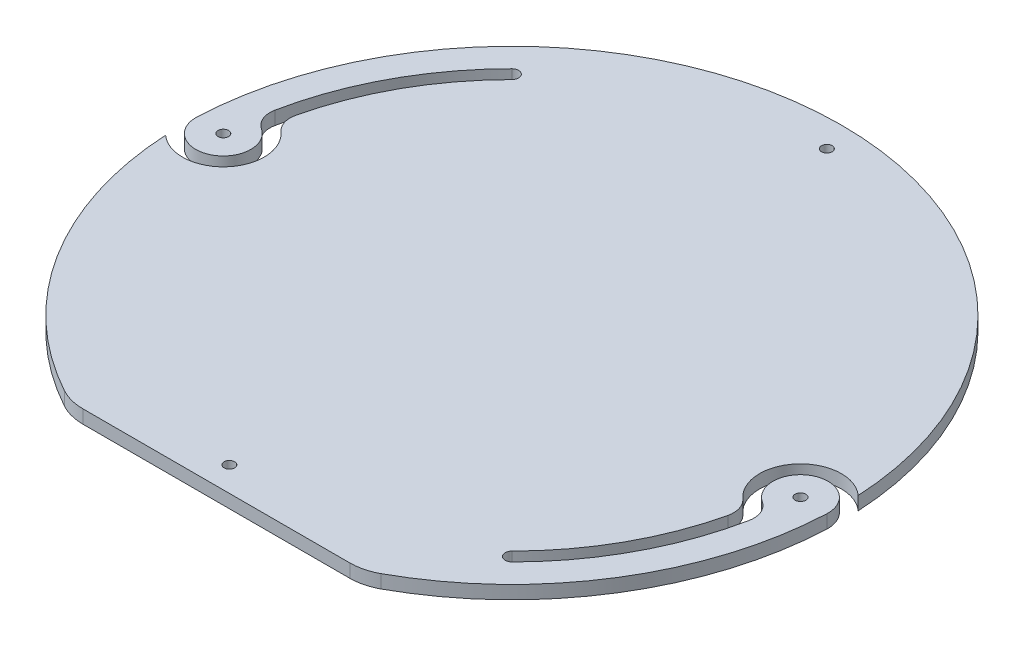
from build123d import *

# Parameters (mm, degrees)
BOSS_EXTRUDE1_DEPTH = 3
SKETCH2_R           = 1.2
CUT_EXTRUDE1_DEPTH  = 105.977521403
CUT_EXTRUDE2_DEPTH  = 105.977521403


with BuildPart() as part:
    # Sketch1 → Boss-Extrude1 (new body)
    with BuildSketch(Plane(origin=(0, 0, 0), x_dir=(1, 0, 0), z_dir=(0, 1, 0))):
        with BuildLine():
            Line((-30.029977361, -66.512867647), (30.029977361, -66.512867647))
            ThreePointArc((30.029977361, -66.512867647), (32.931413623, -66.147401939), (35.651589123, -65.073836471))
            ThreePointArc((35.651589123, -65.073836471), (0, 74.2), (-35.651589123, -65.073836471))
            ThreePointArc((-35.651589123, -65.073836471), (-32.931413623, -66.147401939), (-30.029977361, -66.512867647))
        make_face()
    extrude(amount=BOSS_EXTRUDE1_DEPTH)

    # Sketch2 → Cut-Extrude1 (cut, through all)
    with BuildSketch(Plane(origin=(0, 3, 0), x_dir=(1, 0, 0), z_dir=(0, 1, 0))):
        with Locations((-2.660782629, -60.941941516)):
            Circle(SKETCH2_R)
        with Locations((-67.935279068, 2.966118341)):
            Circle(SKETCH2_R)
        with Locations((2.966118341, 67.935279068)):
            Circle(SKETCH2_R)
        with Locations((67.935279068, -2.966118341)):
            Circle(SKETCH2_R)
    extrude(amount=-CUT_EXTRUDE1_DEPTH, mode=Mode.SUBTRACT)

    # Sketch3 → Cut-Extrude2 (cut, through all)
    with BuildSketch(Plane(origin=(0, 3, 0), x_dir=(1, 0, 0), z_dir=(0, 1, 0))):
        with BuildLine():
            ThreePointArc((-74.129378041, 3.236558543), (-65.111947644, -2.5537367), (-64.529371908, 8.146832232))
            ThreePointArc((-64.529371908, 8.146832232), (-66.395420161, 10.395433666), (-66.686059299, 13.302988203))
            ThreePointArc((-66.686059299, 13.302988203), (-59.961788445, 32.071543875), (-48.083261121, 48.083261121))
            ThreePointArc((-48.083261121, 48.083261121), (-45.961940777, 48.083261121), (-45.961940777, 45.961940777))
            ThreePointArc((-45.961940777, 45.961940777), (-56.839700689, 31.531705085), (-63.324224445, 14.664330822))
            ThreePointArc((-63.324224445, 14.664330822), (-63.220830412, 12.029973663), (-61.791915049, 9.814408532))
            ThreePointArc((-61.791915049, 9.814408532), (-61.096295148, -3.187604024), (-74.099345682, -3.86354364))
            ThreePointArc((-74.099345682, -3.86354364), (-74.19933623, -0.313851977), (-74.129378041, 3.236558543))
        make_face()
        with BuildLine():
            ThreePointArc((74.129378041, -3.236558543), (65.111947644, 2.5537367), (64.529371908, -8.146832232))
            ThreePointArc((64.529371908, -8.146832232), (66.395420161, -10.395433666), (66.686059299, -13.302988203))
            ThreePointArc((66.686059299, -13.302988203), (59.961788445, -32.071543875), (48.083261121, -48.083261121))
            ThreePointArc((48.083261121, -48.083261121), (45.961940777, -48.083261121), (45.961940777, -45.961940777))
            ThreePointArc((45.961940777, -45.961940777), (56.839700689, -31.531705085), (63.324224445, -14.664330822))
            ThreePointArc((63.324224445, -14.664330822), (63.220830412, -12.029973663), (61.791915049, -9.814408532))
            ThreePointArc((61.791915049, -9.814408532), (61.096295148, 3.187604024), (74.099345682, 3.86354364))
            ThreePointArc((74.099345682, 3.86354364), (74.19933623, 0.313851977), (74.129378041, -3.236558543))
        make_face()
    extrude(amount=-CUT_EXTRUDE2_DEPTH, mode=Mode.SUBTRACT)


solid = part.part
